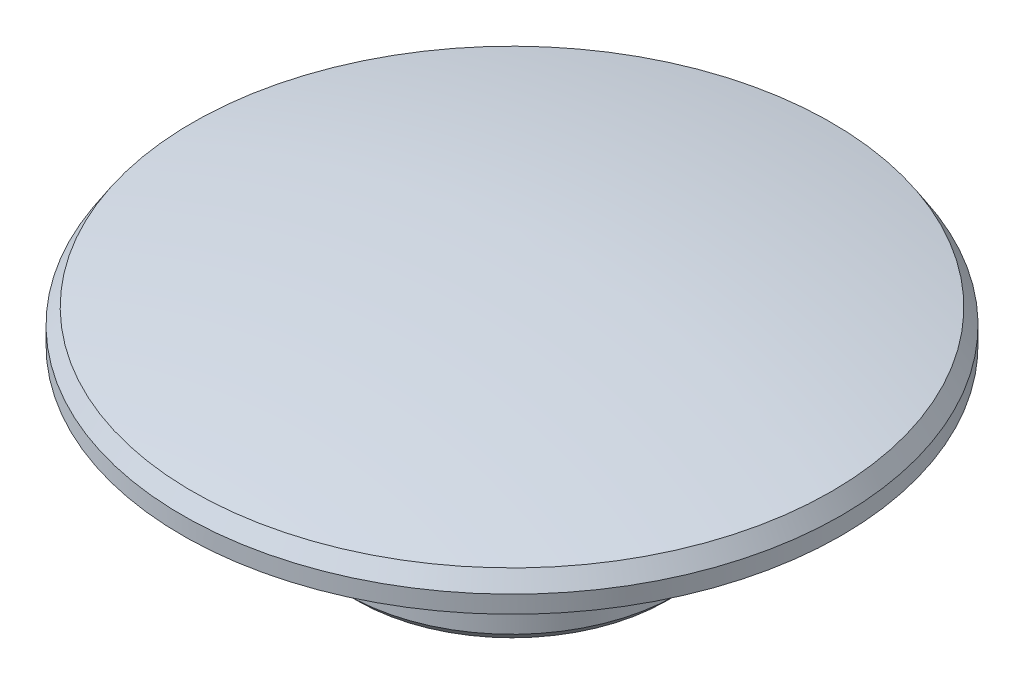
from build123d import *

# Parameters (mm, degrees)
CHAMFER_1_SIZE = 0.655190236
CHAMFER_2_SIZE = 0.5


with BuildPart() as part:
    # ｽｹｯﾁ1 → 回転1 (revolve)
    with BuildSketch(Plane.XY):
        with BuildLine():
            Line((5.7, 0), (5.7, 8))
            Line((5.7, 8), (0, 8))
            Line((0, 8), (0, 10.23))
            ThreePointArc((0, 10.23), (8.046628176, 9.796243245), (16, 8.5))
            Line((16, 8.5), (16, 7))
            Line((16, 7), (8, 7))
            Line((8, 7), (8, 0))
            Line((8, 0), (5.7, 0))
        make_face()
    revolve(axis=Axis((0, 8, 0), (0, 1, 0)))

    # 面取り1
    # the kernel refuses this chamfer: 0.655190236, 0.5 mm, written as the material it takes off along each edge
    with BuildSketch(Plane(origin=(0, 8.5, 0), x_dir=(1, 0, 0), z_dir=(0, 0, 1))) as chamfer_1_piece_1:
        with BuildLine():
            Line((15.512821873, 0.104900382), (16, -CHAMFER_1_SIZE))
            Line((16, -CHAMFER_1_SIZE), (16, 0))
            ThreePointArc((16, 0), (15.747471206, 0.054798761), (15.512821873, 0.104900382))
        make_face()
    revolve(axis=Axis((0, 8.5, 0), (0, 1, 0)), mode=Mode.SUBTRACT)

    # 面取り2
    chamfer_2_edges = [part.edges().sort_by_distance(p)[0] for p in [
        (-5.7, 0, 0),
        (-8, 0, 0),
    ]]
    chamfer(chamfer_2_edges, length=CHAMFER_2_SIZE)


solid = part.part
